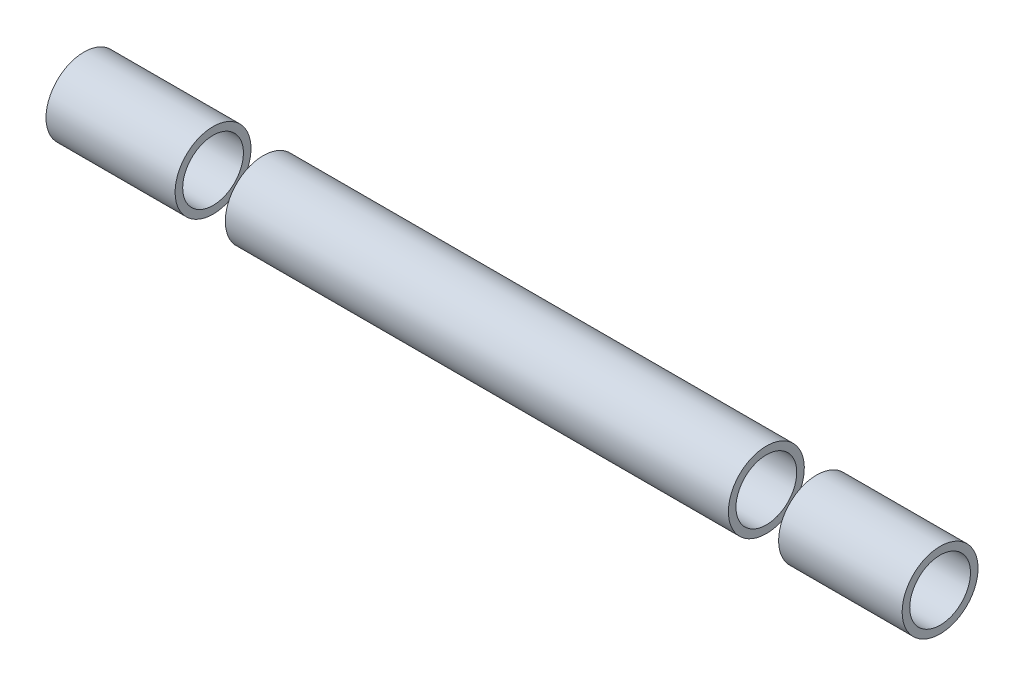
from build123d import *

# Parameters (mm, degrees)
SKETCH1_R               = 15.875
SKETCH1_R_2             = 12.7
EXTRUDE_THIN1_DEPTH     = 180.1495
CUT_EXTRUDE1_DEPTH      = 182.543035119
CUT_EXTRUDE1_DEPTH_BACK = 182.543035119
SKETCH2_W               = 20.99999991
SKETCH2_H               = 31.75
SKETCH2_W_2             = 2.3241


with BuildPart() as part:
    # Sketch1 → Extrude-Thin1 (new, symmetric)
    with BuildSketch(Plane(origin=(0, 0, 0), x_dir=(0, 0, -1), z_dir=(1, 0, 0))):
        Circle(SKETCH1_R)
        Circle(SKETCH1_R_2, mode=Mode.SUBTRACT)
    extrude(amount=EXTRUDE_THIN1_DEPTH, both=True)

    # Sketch2 → Cut-Extrude1 (cut, two sides: drawn at the far end of the back side and taken through both)
    with BuildSketch(Plane.XY.offset(-CUT_EXTRUDE1_DEPTH_BACK)):
        with Locations((115.674500045, 0)):
            Rectangle(SKETCH2_W, SKETCH2_H)
        with Locations((-115.674500045, 0)):
            Rectangle(SKETCH2_W, SKETCH2_H)
        with Locations((178.98745, 0)):
            Rectangle(SKETCH2_W_2, SKETCH2_H)
    extrude(amount=CUT_EXTRUDE1_DEPTH + CUT_EXTRUDE1_DEPTH_BACK, mode=Mode.SUBTRACT)


with BuildPart() as cut_extrude1_piece_1:
    # of the separate pieces the step leaves, piece 1, a body of its own (cut_extrude1_pieces)
    add(part.part.solids().sort_by_distance((-105.17450009, 0, -15.875))[0])


with BuildPart() as cut_extrude1_piece_2:
    # of the separate pieces the step leaves, piece 2, a body of its own (cut_extrude1_pieces)
    add(part.part.solids().sort_by_distance((-180.1495, 0, -15.875))[0])


with BuildPart() as cut_extrude1_piece_3:
    # of the separate pieces the step leaves, piece 3, a body of its own (cut_extrude1_pieces)
    add(part.part.solids().sort_by_distance((126.1745, 0, -15.875))[0])


solid = Compound([cut_extrude1_piece_1.part, cut_extrude1_piece_2.part, cut_extrude1_piece_3.part])
